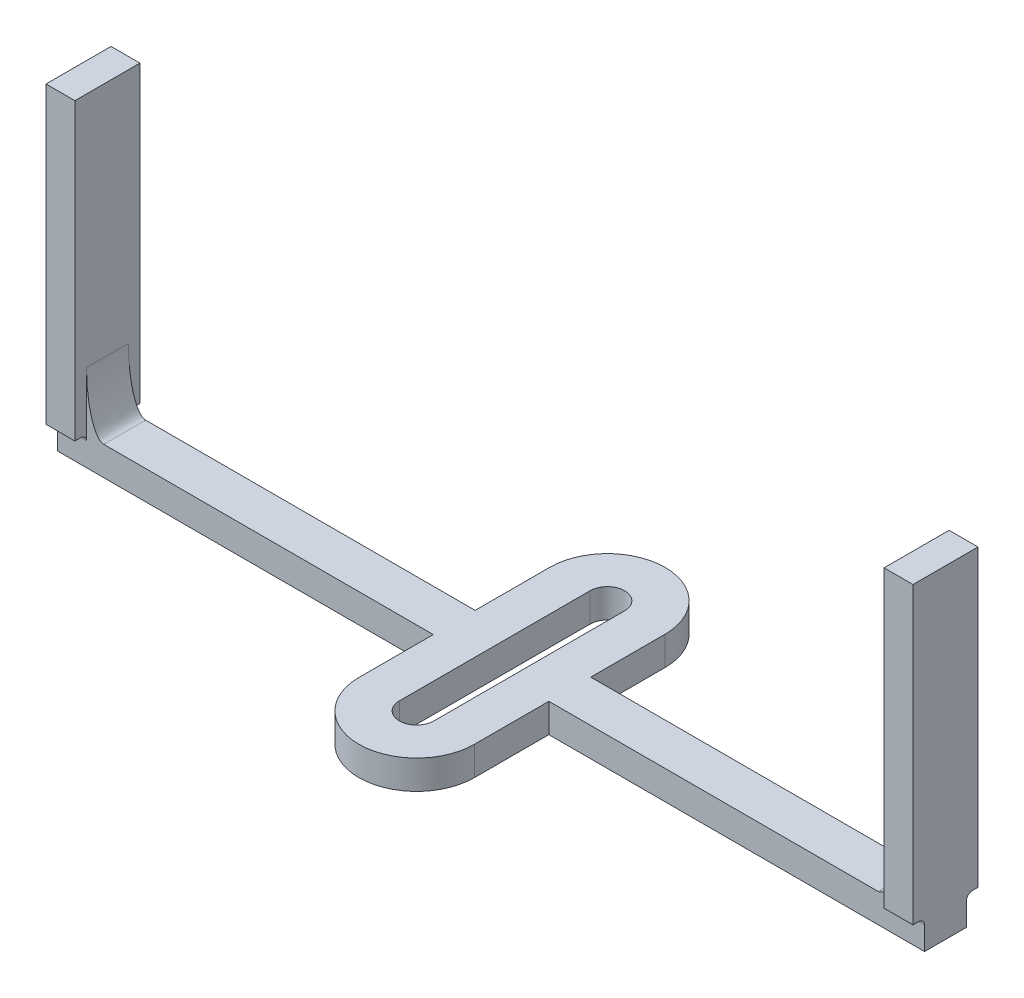
from build123d import *

# Parameters (mm, degrees)
BOSS_EXTRUDE1_DEPTH = 5
SKETCH2_W           = 7.25
SKETCH2_H           = 5
BOSS_EXTRUDE2_DEPTH = 65
SKETCH3_W           = 7.25
SKETCH3_H           = 5
BOSS_EXTRUDE3_DEPTH = 65
SKETCH4_W           = 5
SKETCH4_H           = 11.25
BOSS_EXTRUDE4_DEPTH = 51
FILLET2_R           = 1
FILLET3_SIZE        = 3
FILLET3_SIZE_2      = 10


with BuildPart() as part:
    # Sketch1 → Boss-Extrude1 (new body)
    with BuildSketch(Plane(origin=(0, 0, 0), x_dir=(1, 0, 0), z_dir=(0, 1, 0))):
        with BuildLine():
            Line((10, 33), (10, 0))
            ThreePointArc((10, 0), (0, -10), (-10, 0))
            Line((-10, 0), (-10, 33))
            ThreePointArc((-10, 33), (0, 43), (10, 33))
        make_face()
        with BuildLine():
            Line((-3, 0), (-3, 33))
            ThreePointArc((-3, 33), (0, 36), (3, 33))
            Line((3, 33), (3, 0))
            ThreePointArc((3, 0), (0, -3), (-3, 0))
        make_face(mode=Mode.SUBTRACT)
    extrude(amount=BOSS_EXTRUDE1_DEPTH)

    # Sketch2 → Boss-Extrude2 (add)
    with BuildSketch(Plane(origin=(10, 0, 0), x_dir=(0, 0, -1), z_dir=(1, 0, 0))):
        with Locations((16.5, 2.5)):
            Rectangle(SKETCH2_W, SKETCH2_H)
    extrude(amount=BOSS_EXTRUDE2_DEPTH)

    # Sketch3 → Boss-Extrude3 (add)
    with BuildSketch(Plane.ZY.offset(10)):
        with Locations((-16.5, 2.5)):
            Rectangle(SKETCH3_W, SKETCH3_H)
    extrude(amount=BOSS_EXTRUDE3_DEPTH)

    # Sketch4 → Boss-Extrude4 (add)
    with BuildSketch(Plane(origin=(0, 5, 0), x_dir=(1, 0, 0), z_dir=(0, 1, 0))):
        with Locations((72.5, 16.5)):
            Rectangle(SKETCH4_W, SKETCH4_H)
        with Locations((-72.5, 16.5)):
            Rectangle(SKETCH4_W, SKETCH4_H)
    extrude(amount=BOSS_EXTRUDE4_DEPTH)

    # Fillet2
    fillet2_edges = [part.edges().sort_by_distance(p)[0] for p in [
        (72.5, 5, -20.125),
        (72.5, 5, -12.875),
        (-72.5, 5, -12.875),
        (-72.5, 5, -20.125),
    ]]
    fillet(fillet2_edges, radius=FILLET2_R)

    # Fillet3
    # an asymmetric fillet: 10, 3 mm, written as the material it adds along each edge
    with BuildSketch(Plane(origin=(70, 5, -20.125), x_dir=(-1, 0, 0), z_dir=(0, 0, 1))) as fillet3_piece_1:
        with BuildLine():
            Bezier((FILLET3_SIZE, 0), (0, 0), (0, -FILLET3_SIZE_2), weights=[1, 0.707106781, 1])
            Line((0, -FILLET3_SIZE_2), (0, 0))
            Line((0, 0), (FILLET3_SIZE, 0))
        make_face()
    extrude(amount=7.25)
    with BuildSketch(Plane(origin=(-70, 5, -20.125), x_dir=(0, 1, 0), z_dir=(0, 0, 1))) as fillet3_piece_2:
        with BuildLine():
            Bezier((FILLET3_SIZE_2, 0), (0, 0), (0, -FILLET3_SIZE), weights=[1, 0.707106781, 1])
            Line((0, -FILLET3_SIZE), (0, 0))
            Line((0, 0), (FILLET3_SIZE_2, 0))
        make_face()
    extrude(amount=7.25)


solid = part.part
